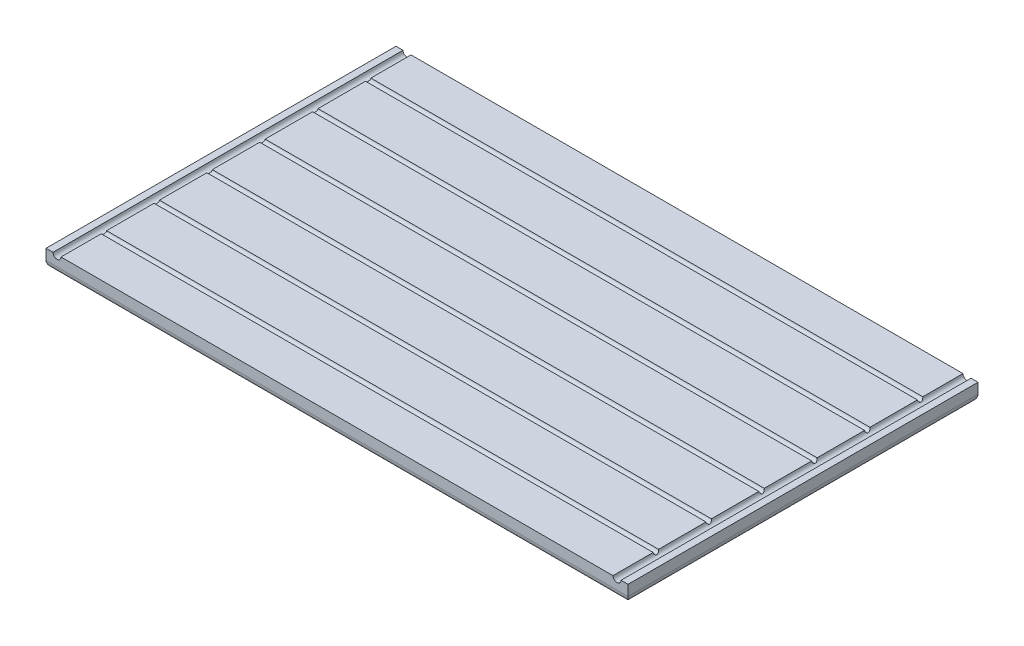
from build123d import *

# Parameters (mm, degrees)
BOSS_EXTRUDE1_DEPTH      = 1000
SKETCH2_R                = 7.75
CUT_EXTRUDE1_DEPTH       = 1942.06579229
FILLET1_R                = 20
BOSS_EXTRUDE2_REACH      = 1943.066
BOSS_EXTRUDE2_END_RADIUS = 11.45
BOSS_EXTRUDE3_REACH      = 1943.066
BOSS_EXTRUDE3_END_RADIUS = 11.45


with BuildPart() as part:
    # Sketch1 → Boss-Extrude1 (new body)
    with BuildSketch(Plane.XY):
        with BuildLine():
            Line((11.45, 0), (1588.55, 0))
            ThreePointArc((1588.55, 0), (1600, -11.45), (1611.45, 0))
            Line((1611.45, 0), (1631.45, 0))
            Line((1631.45, 0), (1631.45, -50))
            Line((1631.45, -50), (-31.45, -50))
            Line((-31.45, -50), (-31.45, 0))
            Line((-31.45, 0), (-11.45, 0))
            ThreePointArc((-11.45, 0), (0, -11.45), (11.45, 0))
        make_face()
    extrude(amount=BOSS_EXTRUDE1_DEPTH)

    # Sketch2 → Cut-Extrude1 (cut, through all)
    with BuildSketch(Plane(origin=(1631.45, 0, 0), x_dir=(0, 0, -1), z_dir=(1, 0, 0))):
        with Locations((-877.5, 0)):
            Circle(SKETCH2_R)
        with Locations((-726.5, 0)):
            Circle(SKETCH2_R)
        with Locations((-575.5, 0)):
            Circle(SKETCH2_R)
        with Locations((-424.5, 0)):
            Circle(SKETCH2_R)
        with Locations((-273.5, 0)):
            Circle(SKETCH2_R)
        with Locations((-122.5, 0)):
            Circle(SKETCH2_R)
    extrude(amount=-CUT_EXTRUDE1_DEPTH, mode=Mode.SUBTRACT)

    # Fillet1
    fillet1_edges = [part.edges().sort_by_distance(p)[0] for p in [
        (-31.45, -50, 500),
        (800, -50, 1000),
        (1631.45, -50, 500),
        (800, -50, 0),
    ]]
    fillet(fillet1_edges, radius=FILLET1_R)

    # Boss-Extrude2: up to this cylinder (the profile starts outside it)
    boss_extrude2_end = Plane(origin=(1600, 0, 500), z_dir=(0, 0, -1)) * Cylinder(BOSS_EXTRUDE2_END_RADIUS, 4665.032, mode=Mode.PRIVATE)
    # Sketch3 → Boss-Extrude2 (add, up to the surface)
    with BuildSketch(Plane(origin=(1631.45, 0, 0), x_dir=(0, 0, -1), z_dir=(1, 0, 0)), mode=Mode.PRIVATE) as boss_extrude2_sk1:
        with BuildLine():
            Line((-885.25, 0), (-869.75, 0))
            ThreePointArc((-869.75, 0), (-877.5, -7.75), (-885.25, 0))
        make_face()
    boss_extrude2_tool1 = extrude(boss_extrude2_sk1.sketch, amount=-BOSS_EXTRUDE2_REACH, mode=Mode.PRIVATE) - boss_extrude2_end
    add(boss_extrude2_tool1.solids().sort_by_distance((1631.45, -3.289202, 877.5))[0])
    # Sketch3 → Boss-Extrude2 (add, up to the surface)
    with BuildSketch(Plane(origin=(1631.45, 0, 0), x_dir=(0, 0, -1), z_dir=(1, 0, 0)), mode=Mode.PRIVATE) as boss_extrude2_sk2:
        with BuildLine():
            Line((-734.25, 0), (-718.75, 0))
            ThreePointArc((-718.75, 0), (-726.5, -7.75), (-734.25, 0))
        make_face()
    boss_extrude2_tool2 = extrude(boss_extrude2_sk2.sketch, amount=-BOSS_EXTRUDE2_REACH, mode=Mode.PRIVATE) - boss_extrude2_end
    add(boss_extrude2_tool2.solids().sort_by_distance((1631.45, -3.289202, 726.5))[0])
    # Sketch3 → Boss-Extrude2 (add, up to the surface)
    with BuildSketch(Plane(origin=(1631.45, 0, 0), x_dir=(0, 0, -1), z_dir=(1, 0, 0)), mode=Mode.PRIVATE) as boss_extrude2_sk3:
        with BuildLine():
            Line((-583.25, 0), (-567.75, 0))
            ThreePointArc((-567.75, 0), (-575.5, -7.75), (-583.25, 0))
        make_face()
    boss_extrude2_tool3 = extrude(boss_extrude2_sk3.sketch, amount=-BOSS_EXTRUDE2_REACH, mode=Mode.PRIVATE) - boss_extrude2_end
    add(boss_extrude2_tool3.solids().sort_by_distance((1631.45, -3.289202, 575.5))[0])
    # Sketch3 → Boss-Extrude2 (add, up to the surface)
    with BuildSketch(Plane(origin=(1631.45, 0, 0), x_dir=(0, 0, -1), z_dir=(1, 0, 0)), mode=Mode.PRIVATE) as boss_extrude2_sk4:
        with BuildLine():
            Line((-432.25, 0), (-416.75, 0))
            ThreePointArc((-416.75, 0), (-424.5, -7.75), (-432.25, 0))
        make_face()
    boss_extrude2_tool4 = extrude(boss_extrude2_sk4.sketch, amount=-BOSS_EXTRUDE2_REACH, mode=Mode.PRIVATE) - boss_extrude2_end
    add(boss_extrude2_tool4.solids().sort_by_distance((1631.45, -3.289202, 424.5))[0])
    # Sketch3 → Boss-Extrude2 (add, up to the surface)
    with BuildSketch(Plane(origin=(1631.45, 0, 0), x_dir=(0, 0, -1), z_dir=(1, 0, 0)), mode=Mode.PRIVATE) as boss_extrude2_sk5:
        with BuildLine():
            Line((-281.25, 0), (-265.75, 0))
            ThreePointArc((-265.75, 0), (-273.5, -7.75), (-281.25, 0))
        make_face()
    boss_extrude2_tool5 = extrude(boss_extrude2_sk5.sketch, amount=-BOSS_EXTRUDE2_REACH, mode=Mode.PRIVATE) - boss_extrude2_end
    add(boss_extrude2_tool5.solids().sort_by_distance((1631.45, -3.289202, 273.5))[0])
    # Sketch3 → Boss-Extrude2 (add, up to the surface)
    with BuildSketch(Plane(origin=(1631.45, 0, 0), x_dir=(0, 0, -1), z_dir=(1, 0, 0)), mode=Mode.PRIVATE) as boss_extrude2_sk6:
        with BuildLine():
            Line((-130.25, 0), (-114.75, 0))
            ThreePointArc((-114.75, 0), (-122.5, -7.75), (-130.25, 0))
        make_face()
    boss_extrude2_tool6 = extrude(boss_extrude2_sk6.sketch, amount=-BOSS_EXTRUDE2_REACH, mode=Mode.PRIVATE) - boss_extrude2_end
    add(boss_extrude2_tool6.solids().sort_by_distance((1631.45, -3.289202, 122.5))[0])

    # Boss-Extrude3: up to this cylinder (the profile starts outside it)
    boss_extrude3_end = Plane(origin=(0, 0, 500), z_dir=(0, 0, -1)) * Cylinder(BOSS_EXTRUDE3_END_RADIUS, 4665.032, mode=Mode.PRIVATE)
    # Sketch4 → Boss-Extrude3 (add, up to the surface)
    with BuildSketch(Plane.ZY.offset(31.45), mode=Mode.PRIVATE) as boss_extrude3_sk1:
        with BuildLine():
            Line((114.75, 0), (130.25, 0))
            ThreePointArc((130.25, 0), (122.5, -7.75), (114.75, 0))
        make_face()
    boss_extrude3_tool1 = extrude(boss_extrude3_sk1.sketch, amount=-BOSS_EXTRUDE3_REACH, mode=Mode.PRIVATE) - boss_extrude3_end
    add(boss_extrude3_tool1.solids().sort_by_distance((-31.45, -3.289202, 122.5))[0])
    # Sketch4 → Boss-Extrude3 (add, up to the surface)
    with BuildSketch(Plane.ZY.offset(31.45), mode=Mode.PRIVATE) as boss_extrude3_sk2:
        with BuildLine():
            Line((265.75, 0), (281.25, 0))
            ThreePointArc((281.25, 0), (273.5, -7.75), (265.75, 0))
        make_face()
    boss_extrude3_tool2 = extrude(boss_extrude3_sk2.sketch, amount=-BOSS_EXTRUDE3_REACH, mode=Mode.PRIVATE) - boss_extrude3_end
    add(boss_extrude3_tool2.solids().sort_by_distance((-31.45, -3.289202, 273.5))[0])
    # Sketch4 → Boss-Extrude3 (add, up to the surface)
    with BuildSketch(Plane.ZY.offset(31.45), mode=Mode.PRIVATE) as boss_extrude3_sk3:
        with BuildLine():
            Line((416.75, 0), (432.25, 0))
            ThreePointArc((432.25, 0), (424.5, -7.75), (416.75, 0))
        make_face()
    boss_extrude3_tool3 = extrude(boss_extrude3_sk3.sketch, amount=-BOSS_EXTRUDE3_REACH, mode=Mode.PRIVATE) - boss_extrude3_end
    add(boss_extrude3_tool3.solids().sort_by_distance((-31.45, -3.289202, 424.5))[0])
    # Sketch4 → Boss-Extrude3 (add, up to the surface)
    with BuildSketch(Plane.ZY.offset(31.45), mode=Mode.PRIVATE) as boss_extrude3_sk4:
        with BuildLine():
            Line((567.75, 0), (583.25, 0))
            ThreePointArc((583.25, 0), (575.5, -7.75), (567.75, 0))
        make_face()
    boss_extrude3_tool4 = extrude(boss_extrude3_sk4.sketch, amount=-BOSS_EXTRUDE3_REACH, mode=Mode.PRIVATE) - boss_extrude3_end
    add(boss_extrude3_tool4.solids().sort_by_distance((-31.45, -3.289202, 575.5))[0])
    # Sketch4 → Boss-Extrude3 (add, up to the surface)
    with BuildSketch(Plane.ZY.offset(31.45), mode=Mode.PRIVATE) as boss_extrude3_sk5:
        with BuildLine():
            Line((718.75, 0), (734.25, 0))
            ThreePointArc((734.25, 0), (726.5, -7.75), (718.75, 0))
        make_face()
    boss_extrude3_tool5 = extrude(boss_extrude3_sk5.sketch, amount=-BOSS_EXTRUDE3_REACH, mode=Mode.PRIVATE) - boss_extrude3_end
    add(boss_extrude3_tool5.solids().sort_by_distance((-31.45, -3.289202, 726.5))[0])
    # Sketch4 → Boss-Extrude3 (add, up to the surface)
    with BuildSketch(Plane.ZY.offset(31.45), mode=Mode.PRIVATE) as boss_extrude3_sk6:
        with BuildLine():
            Line((869.75, 0), (885.25, 0))
            ThreePointArc((885.25, 0), (877.5, -7.75), (869.75, 0))
        make_face()
    boss_extrude3_tool6 = extrude(boss_extrude3_sk6.sketch, amount=-BOSS_EXTRUDE3_REACH, mode=Mode.PRIVATE) - boss_extrude3_end
    add(boss_extrude3_tool6.solids().sort_by_distance((-31.45, -3.289202, 877.5))[0])


solid = part.part
